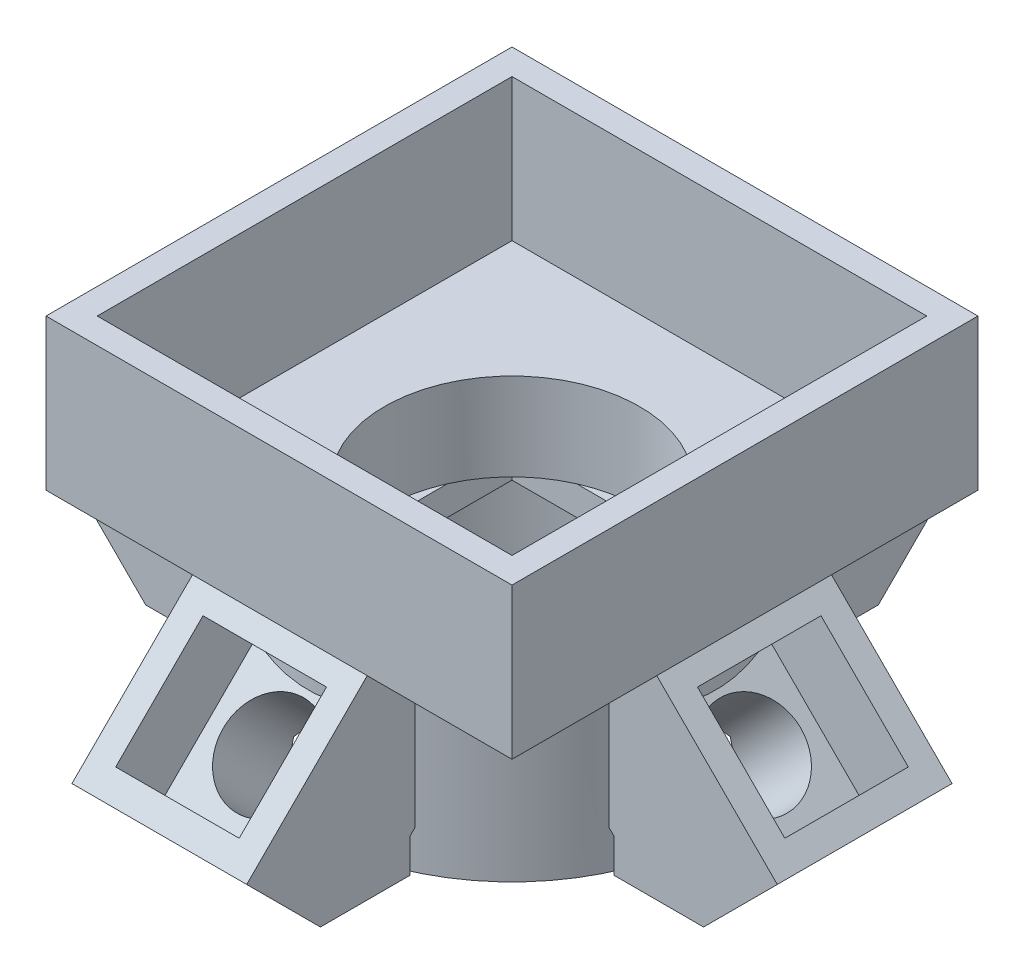
from build123d import *
from build123d.topology import SkipClean

# Parameters (mm, degrees)
SKETCH6_R            = 3
SKETCH6_R_2          = 2.19
BOSS_EXTRUDE3_DEPTH  = 2
SKETCH7_W            = 4
SKETCH7_H            = 4
CUT_EXTRUDE2_DEPTH   = 0.5
BOSS_EXTRUDE5_START  = 0.5
BOSS_EXTRUDE5_DEPTH  = 0.5
SKETCH17_R           = 3.5
SKETCH17_R_2         = 3
BOSS_EXTRUDE11_DEPTH = 0.5
BOSS_EXTRUDE12_START = 2
SKETCH18_R           = 3.5
SKETCH18_R_2         = 3.1
BOSS_EXTRUDE12_DEPTH = 2
BOSS_EXTRUDE13_DEPTH = 1.5
SKETCH29_W           = 3
SKETCH29_H           = 3
BOSS_EXTRUDE16_DEPTH = 1.5
SKETCH30_W           = 2.12
SKETCH30_H           = 2.12
CUT_EXTRUDE10_DEPTH  = 2.645512986
SKETCH31_W           = 2.22
SKETCH31_H           = 2.22
BOSS_EXTRUDE17_DEPTH = 1.27
SKETCH32_R           = 0.81
CUT_EXTRUDE11_DEPTH  = 8.729286762
SKETCH33_W           = 3.2
SKETCH33_H           = 3.2
CUT_EXTRUDE12_DEPTH  = 0.18
CIRPATTERN3_COUNT    = 4
SKETCH34_W           = 2.14
SKETCH34_H           = 2.16
CUT_EXTRUDE13_DEPTH  = 2.645512986
SKETCH35_W           = 2.12
SKETCH35_H           = 2.12
CUT_EXTRUDE14_DEPTH  = 2.645512986
SKETCH36_W           = 2.12
SKETCH36_H           = 2.12
CUT_EXTRUDE15_DEPTH  = 2.645512986
CIRPATTERN16_COUNT   = 4
SKETCH37_R           = 10
CUT_EXTRUDE17_DEPTH  = 0.5
SKETCH38_R           = 3.5
SKETCH38_R_2         = 2.85
BOSS_EXTRUDE18_DEPTH = 1.5
SKETCH39_W           = 2.12
SKETCH39_H           = 2.12
CUT_EXTRUDE18_DEPTH  = 0.5
SKETCH40_W           = 8
SKETCH40_H           = 8
SKETCH40_W_2         = 7
SKETCH40_H_2         = 7
BOSS_EXTRUDE19_DEPTH = 2.44
BOSS_EXTRUDE20_START = 0.15
SKETCH41_W           = 8
SKETCH41_H           = 8
SKETCH41_R           = 2.19
BOSS_EXTRUDE20_DEPTH = 0.15
SKETCH42_W           = 8
SKETCH42_H           = 8
SKETCH42_R           = 2.19
BOSS_EXTRUDE21_DEPTH = 0.733937
BOSS_EXTRUDE21_DRAFT = 45
SKETCH43_W           = 7.12
SKETCH43_H           = 7.12
CUT_EXTRUDE19_DEPTH  = 10


with BuildPart() as part:
    # Sketch6 → Boss-Extrude3 (new body)
    with BuildSketch(Plane(origin=(0, 0, 0), x_dir=(1, 0, 0), z_dir=(0, 1, 0))):
        with Locations(Location((0, 0, 0), (0, 0, 270))):
            Circle(SKETCH6_R)
        with Locations(Location((0, 0, 0), (0, 0, 270))):
            Circle(SKETCH6_R_2, mode=Mode.SUBTRACT)
    extrude(amount=BOSS_EXTRUDE3_DEPTH)

    # Sketch7 → Cut-Extrude2 (cut)
    with BuildSketch(Plane(origin=(0, 0, 0), x_dir=(-1, 0, 0), z_dir=(0, -1, 0))):
        Rectangle(SKETCH7_W, SKETCH7_H)
    extrude(amount=-CUT_EXTRUDE2_DEPTH, mode=Mode.SUBTRACT)

    # Sketch8 → Boss-Extrude5 (add)
    with BuildSketch(Plane(origin=(0, 0.5, 0), x_dir=(-1, 0, 0), z_dir=(0, -1, 0)).offset(BOSS_EXTRUDE5_START)):
        with BuildLine():
            Line((-0.892244361, 2), (0.892244361, 2))
            ThreePointArc((0.892244361, 2), (0, 2.19), (-0.892244361, 2))
        make_face()
        with BuildLine():
            Line((-2, 0.892244361), (-2, -0.892244361))
            ThreePointArc((-2, -0.892244361), (-2.19, 0), (-2, 0.892244361))
        make_face()
        with BuildLine():
            Line((-0.892244361, -2), (0.892244361, -2))
            ThreePointArc((0.892244361, -2), (0, -2.19), (-0.892244361, -2))
        make_face()
        with BuildLine():
            Line((2, 0.892244361), (2, -0.892244361))
            ThreePointArc((2, -0.892244361), (2.19, 0), (2, 0.892244361))
        make_face()
    extrude(amount=-BOSS_EXTRUDE5_DEPTH)

    # Sketch17 → Boss-Extrude11 (add)
    with BuildSketch(Plane(origin=(0, 0, 0), x_dir=(-1, 0, 0), z_dir=(0, -1, 0))):
        with Locations(Location((0, 0, 0), (0, 0, 90))):
            Circle(SKETCH17_R)
        with Locations(Location((0, 0, 0), (0, 0, 90))):
            Circle(SKETCH17_R_2, mode=Mode.SUBTRACT)
    extrude(amount=-BOSS_EXTRUDE11_DEPTH)

    # Sketch18 → Boss-Extrude12 (add)
    with BuildSketch(Plane(origin=(0, 0, 0), x_dir=(-1, 0, 0), z_dir=(0, -1, 0)).offset(BOSS_EXTRUDE12_START)):
        with Locations(Location((0, 0, 0), (0, 0, 90))):
            Circle(SKETCH18_R)
        with Locations(Location((0, 0, 0), (0, 0, 90))):
            Circle(SKETCH18_R_2, mode=Mode.SUBTRACT)
    extrude(amount=-BOSS_EXTRUDE12_DEPTH)

    # Sketch19 → Boss-Extrude13 (add, symmetric)
    with BuildSketch(Plane.XY):
        Polygon((4.288855584, -2), (5.121320344, -1.167535241), (3, 0.953785103), (2.19, 0.143785103), (3.250660172, -0.916875069), (3.250660172, -2), (4.033756176, -2), align=None)
    boss_extrude13 = extrude(amount=BOSS_EXTRUDE13_DEPTH, both=True)

    # Sketch29 → Boss-Extrude16 (add)
    with BuildSketch(Plane(origin=(1.976892551, 1.976892551, 0), x_dir=(0, 0, -1), z_dir=(0.707106781186548, 0.7071067811865471, 0))):
        with Locations((0, -2.94689243)):
            Rectangle(SKETCH29_W, SKETCH29_H)
    boss_extrude16 = extrude(amount=BOSS_EXTRUDE16_DEPTH)

    # Sketch30 → Cut-Extrude10 (cut)
    with BuildSketch(Plane(origin=(3.037552723, 3.037552723, 0), x_dir=(0, 0, -1), z_dir=(0.707106781186548, 0.7071067811865471, 0))):
        with Locations((0, -2.94689243)):
            Rectangle(SKETCH30_W, SKETCH30_H)
    extrude(amount=-CUT_EXTRUDE10_DEPTH, mode=Mode.SUBTRACT)

    # Sketch31 → Boss-Extrude17 (add)
    with BuildSketch(Plane(origin=(1.166892551, 1.166892551, 0), x_dir=(0, 0, 1), z_dir=(-0.7071067811865441, -0.7071067811865509, 0))):
        with Locations((-0.05, -2.89689243)):
            Rectangle(SKETCH31_W, SKETCH31_H)
    boss_extrude17 = extrude(amount=-BOSS_EXTRUDE17_DEPTH)

    # Sketch32 → Cut-Extrude11 (cut, symmetric)
    with BuildSketch(Plane(origin=(2.064918163, 2.064918163, 0), x_dir=(0, 0, -1), z_dir=(0.7071067811865444, 0.7071067811865508, 0))):
        with Locations(Location((0, -2.94689243, 0), (0, 0, 155.306163656))):
            Circle(SKETCH32_R)
    cut_extrude11 = extrude(amount=CUT_EXTRUDE11_DEPTH, both=True, mode=Mode.SUBTRACT)

    # Sketch33 → Cut-Extrude12 (cut)
    with BuildSketch(Plane(origin=(3.037552723, 3.037552723, 0), x_dir=(0, 0, -1), z_dir=(0.707106781186548, 0.7071067811865471, 0))):
        with Locations((0, -2.94689243)):
            Rectangle(SKETCH33_W, SKETCH33_H)
    cut_extrude12 = extrude(amount=-CUT_EXTRUDE12_DEPTH, mode=Mode.SUBTRACT)

    # CirPattern3: Boss-Extrude13, Boss-Extrude16 ×4 about axis
    cirpattern3_axis = Axis((0, 0, 0), (0, 1, 0))
    add([boss_extrude13.rotate(cirpattern3_axis, i * 360 / CIRPATTERN3_COUNT) for i in range(1, CIRPATTERN3_COUNT)])
    add([boss_extrude16.rotate(cirpattern3_axis, i * 360 / CIRPATTERN3_COUNT) for i in range(1, CIRPATTERN3_COUNT)])

    # Sketch34 → Cut-Extrude13 (cut)
    with BuildSketch(Plane(origin=(-3.037552723, 3.037552723, 0), x_dir=(0, 0, 1), z_dir=(-0.707106781186548, 0.7071067811865471, 0))):
        with Locations((0, -2.94689243)):
            Rectangle(SKETCH34_W, SKETCH34_H)
    extrude(amount=-CUT_EXTRUDE13_DEPTH, mode=Mode.SUBTRACT)

    # Sketch35 → Cut-Extrude14 (cut)
    with BuildSketch(Plane(origin=(0, 3.037552723, -3.037552723), x_dir=(1, 0, 0), z_dir=(7.355440612690688e-15, 0.7071067811865471, -0.707106781186548))):
        with Locations((0, 2.94689243)):
            Rectangle(SKETCH35_W, SKETCH35_H)
    extrude(amount=-CUT_EXTRUDE14_DEPTH, mode=Mode.SUBTRACT)

    # Sketch36 → Cut-Extrude15 (cut)
    with BuildSketch(Plane(origin=(0, 3.037552723, 3.037552723), x_dir=(1, 0, 0), z_dir=(-2.417740350526155e-15, 0.7071067811865471, 0.707106781186548))):
        with Locations((0, -2.94689243)):
            Rectangle(SKETCH36_W, SKETCH36_H)
    extrude(amount=-CUT_EXTRUDE15_DEPTH, mode=Mode.SUBTRACT)

    # CirPattern16: Boss-Extrude17, Cut-Extrude11, Cut-Extrude12 ×4 about axis
    cirpattern16_axis = Axis((0, 0, 0), (0, 1, 0))
    add([boss_extrude17.rotate(cirpattern16_axis, i * 360 / CIRPATTERN16_COUNT) for i in range(1, CIRPATTERN16_COUNT)])
    add([cut_extrude11.rotate(cirpattern16_axis, i * 360 / CIRPATTERN16_COUNT) for i in range(1, CIRPATTERN16_COUNT)], mode=Mode.SUBTRACT)
    add([cut_extrude12.rotate(cirpattern16_axis, i * 360 / CIRPATTERN16_COUNT) for i in range(1, CIRPATTERN16_COUNT)], mode=Mode.SUBTRACT)

    # Sketch37 → Cut-Extrude17 (cut)
    with BuildSketch(Plane.XZ.offset(2)):
        Circle(SKETCH37_R)
    extrude(amount=-CUT_EXTRUDE17_DEPTH, mode=Mode.SUBTRACT)

    # Sketch38 → Boss-Extrude18 (add)
    with SkipClean():  # the faces are left unmerged after this step: merging them gives an invalid solid
        with BuildSketch(Plane(origin=(0, 0.5, 0), x_dir=(1, 0, 0), z_dir=(0, 1, 0))):
            with Locations(Location((0, 0, 0), (0, 0, 111.75765302))):
                Circle(SKETCH38_R)
            Circle(SKETCH38_R_2, mode=Mode.SUBTRACT)
        extrude(amount=BOSS_EXTRUDE18_DEPTH)
    add(part.part.scale(1), mode=Mode.REPLACE)  # the faces are merged on a copy

    # Sketch39 → Cut-Extrude18 (cut)
    with BuildSketch(Plane(origin=(0, 2.064918163, -2.064918163), x_dir=(1, 0, 0), z_dir=(-2.4688501310822543e-15, 0.7071067811865508, -0.7071067811865444))):
        with Locations((0, 2.94689243)):
            Rectangle(SKETCH39_W, SKETCH39_H)
    extrude(amount=CUT_EXTRUDE18_DEPTH, mode=Mode.SUBTRACT)



with BuildPart() as body_2:
    # Sketch40 → Boss-Extrude19 (new body)
    with BuildSketch(Plane(origin=(0, 2, 0), x_dir=(1, 0, 0), z_dir=(0, 1, 0))):
        Rectangle(SKETCH40_W, SKETCH40_H)
        Rectangle(SKETCH40_W_2, SKETCH40_H_2, mode=Mode.SUBTRACT)
    extrude(amount=BOSS_EXTRUDE19_DEPTH)


with BuildPart() as part_1:
    with SkipClean():  # the faces are left unmerged after this step: merging them gives an invalid solid
        add(part.part)

        add(body_2.part)  # Boss-Extrude20 merges body 2
        # Sketch41 → Boss-Extrude20 (add)
        with BuildSketch(Plane.XZ.offset(-2).offset(BOSS_EXTRUDE20_START)):
            Rectangle(SKETCH41_W, SKETCH41_H)
            with Locations(Location((0, 0, 0), (0, 0, 294.042710138))):
                Circle(SKETCH41_R, mode=Mode.SUBTRACT)
        extrude(amount=-BOSS_EXTRUDE20_DEPTH)


with BuildPart() as boss_extrude21_tool:
    # Sketch42 → Boss-Extrude21 (with draft: the straight prism first)
    with BuildSketch(Plane.XZ.offset(-1.85)):
        Rectangle(SKETCH42_W, SKETCH42_H)
        with Locations(Location((0, 0, 0), (0, 0, 294.042710138))):
            Circle(SKETCH42_R, mode=Mode.SUBTRACT)
    extrude(amount=BOSS_EXTRUDE21_DEPTH)
    # Boss-Extrude21: the draft: its side faces are tilted about the plane it starts from
    boss_extrude21_sides = [boss_extrude21_tool.faces().sort_by_distance(p)[0] for p in [
        (-4, 1.4830315, 0),
        (0, 1.4830315, -4),
        (4, 1.4830315, 0),
        (0, 1.4830315, 4),
        (-0.892244361, 1.4830315, 2),
    ]]
    draft(boss_extrude21_sides, Plane.XZ.offset(-1.85), BOSS_EXTRUDE21_DRAFT)


with BuildPart() as part_2:
    add(part_1.part)

    # Boss-Extrude21: add boss_extrude21_tool
    add(boss_extrude21_tool.part)

    # Sketch43 → Cut-Extrude19 (cut)
    with BuildSketch(Plane(origin=(0, 2, 0), x_dir=(1, 0, 0), z_dir=(0, 1, 0))):
        Rectangle(SKETCH43_W, SKETCH43_H)
    extrude(amount=CUT_EXTRUDE19_DEPTH, mode=Mode.SUBTRACT)


solid = part_2.part
